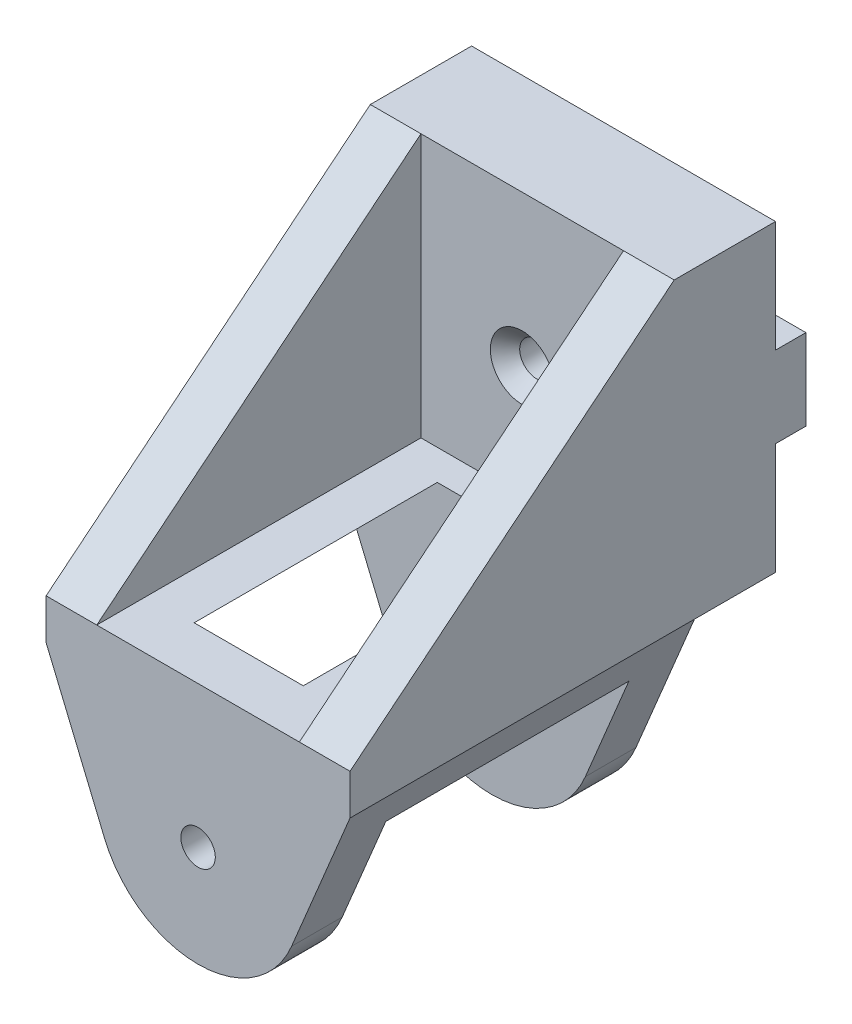
from build123d import *

# Parameters (mm, degrees)
EXTRUDE_1_DEPTH     = 42
SKETCH_2_R          = 15
CUT_EXTRUDE_1_DEPTH = 12
SKETCH_3_W          = 30
SKETCH_3_H          = 20
CUT_EXTRUDE_2_DEPTH = 8
SKETCH_4_W          = 5
SKETCH_4_H          = 8
EXTRUDE_2_DEPTH     = 3
OTHER_START         = 8
OTHER_1_OUTLINE_R   = 1.7
OTHER_1_DEPTH       = 34
SKETCH_7_W          = 20
SKETCH_7_H          = 32
CUT_EXTRUDE_6_DEPTH = 26
CUT_EXTRUDE_7_DEPTH = 60.699246226


# Read off the part's stored shape, not the designer's step: 高级异型孔1, 高级异型孔2
with BuildPart() as part:
    # 草图1 → 凸台-拉伸1 (new body)
    with BuildSketch(Plane.XY):
        with BuildLine():
            Line((0, 0), (5.769230769, -13.846153846))
            ThreePointArc((5.769230769, -13.846153846), (15, -20), (24.230769231, -13.846153846))
            Line((24.230769231, -13.846153846), (30, 0))
            Line((30, 0), (30, 30))
            Line((30, 30), (0, 30))
            Line((0, 30), (0, 0))
        make_face()
    extrude(amount=EXTRUDE_1_DEPTH)

    # 草图2 → 切除-拉伸1 (cut, symmetric)
    with BuildSketch(Plane(origin=(0, 0, 25), x_dir=(-1, 0, 0), z_dir=(0, 0, -1))):
        with Locations((-15, -10)):
            Circle(SKETCH_2_R)
    extrude(amount=CUT_EXTRUDE_1_DEPTH, both=True, mode=Mode.SUBTRACT)

    # 草图3 → 切除-拉伸2 (cut)
    with BuildSketch(Plane(origin=(0, 0, 0), x_dir=(-1, 0, 0), z_dir=(0, 0, -1))):
        with Locations((-15, -10)):
            Rectangle(SKETCH_3_W, SKETCH_3_H)
    extrude(amount=-CUT_EXTRUDE_2_DEPTH, mode=Mode.SUBTRACT)

    # 草图4 → 凸台-拉伸2 (add)
    with BuildSketch(Plane(origin=(0, 0, 0), x_dir=(-1, 0, 0), z_dir=(0, 0, -1))):
        with Locations((-27.5, 15)):
            Rectangle(SKETCH_4_W, SKETCH_4_H)
        with Locations((-2.5, 15)):
            Rectangle(SKETCH_4_W, SKETCH_4_H)
    extrude(amount=EXTRUDE_2_DEPTH)

    # 高级异型孔1 outline → 高级异型孔1 (cut)
    with BuildSketch(Plane.XY.offset(OTHER_START)):
        with Locations((15, -10)):
            Circle(OTHER_1_OUTLINE_R)
    extrude(amount=OTHER_1_DEPTH, mode=Mode.SUBTRACT)

    # 草图7 → 切除-拉伸6 (cut)
    with BuildSketch(Plane(origin=(0, 30, 0), x_dir=(1, 0, 0), z_dir=(0, 1, 0))):
        with Locations((15, -26)):
            Rectangle(SKETCH_7_W, SKETCH_7_H)
    extrude(amount=-CUT_EXTRUDE_6_DEPTH, mode=Mode.SUBTRACT)

    # 草图8 → 切除-拉伸7 (cut, through all)
    with BuildSketch(Plane(origin=(30, 0, 0), x_dir=(0, 0, -1), z_dir=(1, 0, 0))):
        Polygon((-42, 30), (-10, 30), (-42, 4), align=None)
    extrude(amount=-CUT_EXTRUDE_7_DEPTH, mode=Mode.SUBTRACT)

    # 高级异型孔2 outline → 高级异型孔2 (revolve, cut)
    with BuildSketch(Plane(origin=(15, 15, 0), x_dir=(1, 0, 0), z_dir=(0, -1, 0))):
        Polygon((0, 0), (1.7, 0), (1.7, 8.55), (3.15, 10), (0, 10), align=None)
    revolve(axis=Axis((15, 15, 0), (0, 0, 1)), mode=Mode.SUBTRACT)


solid = part.part
